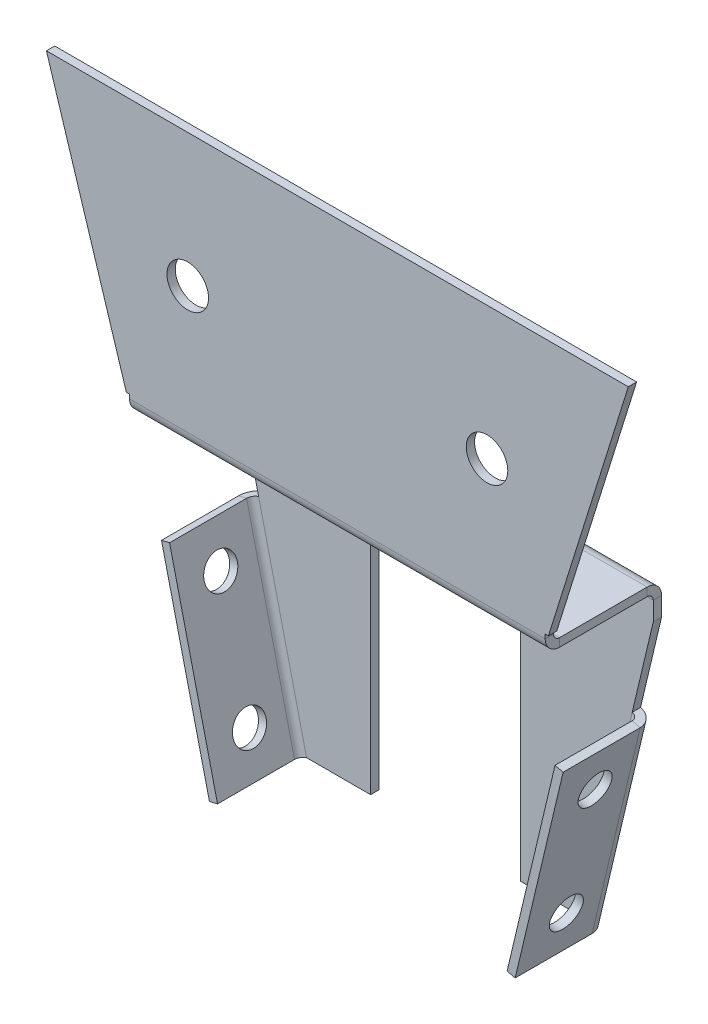
from build123d import *

# Parameters (mm, degrees)
IZIM1_R                         = 2.5
TABAN_FLAN_1_DEPTH              = 1
KENAR_FLAN_1_STRIP_W            = 5.4732
KENAR_FLAN_1_STRIP_H            = 1
KENAR_FLAN_1_STRIP_CUT_DEPTH    = 50
KENAR_FLAN_1_RELIEF_W           = 5.9732
KENAR_FLAN_1_RELIEF_H           = 0.5
KENAR_FLAN_1_RELIEF_CUT_DEPTH   = 1
KENAR_FLAN_1_DEPTH              = 50
KENAR_FLAN_1_START              = 1
KENAR_FLAN_1_FLAT_DEPTH         = 1
KENAR_FLAN_2_STRIP_W            = 5.4732
KENAR_FLAN_2_STRIP_H            = 1
KENAR_FLAN_2_STRIP_CUT_DEPTH    = 16
KENAR_FLAN_2_RELIEF_W           = 5.9732
KENAR_FLAN_2_RELIEF_H           = 0.5
KENAR_FLAN_2_RELIEF_CUT_DEPTH   = 1
KENAR_FLAN_2_STRIP_2_W          = 5.4732
KENAR_FLAN_2_STRIP_2_H          = 1
KENAR_FLAN_2_STRIP_CUT_2_DEPTH  = 16
KENAR_FLAN_2_RELIEF_2_W         = 5.9732
KENAR_FLAN_2_RELIEF_2_H         = 0.5
KENAR_FLAN_2_RELIEF_CUT_2_DEPTH = 1
KENAR_FLAN_2_DEPTH              = 16
KENAR_FLAN_2_BEND_DEPTH         = 16
KES_EKSTR_ZYON1_DEPTH           = 10
KENAR_FLAN_3_DEPTH              = 25
KENAR_FLAN_3_START              = 1
KENAR_FLAN_3_PROFILE_W          = 25
KENAR_FLAN_3_PROFILE_H          = 9.2634
KENAR_FLAN_3_PROFILE_R          = 2
KENAR_FLAN_3_FLAT_DEPTH         = 1
KENAR_FLAN_3_BEND_DEPTH         = 25
KENAR_FLAN_3_PROFILE_2_W        = 25
KENAR_FLAN_3_PROFILE_2_H        = 9.2634
KENAR_FLAN_3_PROFILE_2_R        = 2
KENAR_FLAN_3_FLAT_2_DEPTH       = 1


# Sheet-metal steps are written as plain solids
with BuildPart() as part:
    # Çizim1 → Taban-Flanş1 (new body)
    with BuildSketch(Plane.XY):
        Polygon((-25, 16), (25, 16), (35, 16), (25, -16), (-25, -16), (-35, 16), align=None)
        with Locations((-18, 0)):
            Circle(IZIM1_R, mode=Mode.SUBTRACT)
        with Locations((18, 0)):
            Circle(IZIM1_R, mode=Mode.SUBTRACT)
    extrude(amount=-TABAN_FLAN_1_DEPTH)

    # Kenar-Flanş1 strip (across the edge) → Kenar-Flanş1 strip cut (cut)
    with BuildSketch(Plane(origin=(25, -16, -1), x_dir=(0, 1, 0), z_dir=(-1, 0, 0))):
        with Locations((-2, -0.5)):
            Rectangle(KENAR_FLAN_1_STRIP_W, KENAR_FLAN_1_STRIP_H)
    extrude(amount=KENAR_FLAN_1_STRIP_CUT_DEPTH, mode=Mode.SUBTRACT)

    # Kenar-Flanş1 relief (on the sheet) → Kenar-Flanş1 relief cut (cut)
    with BuildSketch(Plane(origin=(25, -15.2634, -1), x_dir=(0, 1, 0), z_dir=(0, 0, -1))):
        with Locations((-2.4866, 0.25)):
            Rectangle(KENAR_FLAN_1_RELIEF_W, KENAR_FLAN_1_RELIEF_H)
        with Locations((-2.4866, -50.25)):
            Rectangle(KENAR_FLAN_1_RELIEF_W, KENAR_FLAN_1_RELIEF_H)
    extrude(amount=-KENAR_FLAN_1_RELIEF_CUT_DEPTH, mode=Mode.SUBTRACT)

    # Kenar-Flanş1 bend section (across the edge) → Kenar-Flanş1 (add)
    with BuildSketch(Plane(origin=(25, -16, -1), x_dir=(0, 1, 0), z_dir=(-1, 0, 0))):
        with BuildLine():
            Line((-1, 0.7366), (0, 0.7366))
            ThreePointArc((0, 0.7366), (0.215745145, 0.215745145), (0.7366, 0))
            Line((0.7366, 0), (0.7366, -1))
            ThreePointArc((0.7366, -1), (-0.491361636, -0.491361636), (-1, 0.7366))
        make_face()
    extrude(amount=KENAR_FLAN_1_DEPTH)

    # Kenar-Flanş1 profile (on flange) → Kenar-Flanş1 flat (add)
    with BuildSketch(Plane(origin=(0, -16, -1), x_dir=(-1, 0, 0), z_dir=(0, -1, 0)).offset(KENAR_FLAN_1_START)):
        with BuildLine():
            Line((25, 0.7366), (25, 12))
            Line((25, 12), (9, 12))
            ThreePointArc((9, 12), (0, 3), (-9, 12))
            Line((-9, 12), (-25, 12))
            Line((-25, 12), (-25, 0.7366))
            Line((-25, 0.7366), (25, 0.7366))
        make_face()
    extrude(amount=-KENAR_FLAN_1_FLAT_DEPTH)

    # Kenar-Flanş2 strip (across the edge) → Kenar-Flanş2 strip cut (cut)
    with BuildSketch(Plane(origin=(9, -17, -13), x_dir=(0, 0, 1), z_dir=(1, 0, 0))):
        with Locations((-2, -0.5)):
            Rectangle(KENAR_FLAN_2_STRIP_W, KENAR_FLAN_2_STRIP_H)
    extrude(amount=KENAR_FLAN_2_STRIP_CUT_DEPTH, mode=Mode.SUBTRACT)

    # Kenar-Flanş2 relief (on the sheet) → Kenar-Flanş2 relief cut (cut)
    with BuildSketch(Plane(origin=(9, -17, -12.2634), x_dir=(0, 0, 1), z_dir=(0, -1, 0))):
        with Locations((-2.4866, 0.25)):
            Rectangle(KENAR_FLAN_2_RELIEF_W, KENAR_FLAN_2_RELIEF_H)
    extrude(amount=-KENAR_FLAN_2_RELIEF_CUT_DEPTH, mode=Mode.SUBTRACT)

    # Kenar-Flanş2 strip 2 (across the edge) → Kenar-Flanş2 strip cut 2 (cut)
    with BuildSketch(Plane(origin=(-25, -17, -13), x_dir=(0, 0, 1), z_dir=(1, 0, 0))):
        with Locations((-2, -0.5)):
            Rectangle(KENAR_FLAN_2_STRIP_2_W, KENAR_FLAN_2_STRIP_2_H)
    extrude(amount=KENAR_FLAN_2_STRIP_CUT_2_DEPTH, mode=Mode.SUBTRACT)

    # Kenar-Flanş2 relief 2 (on the sheet) → Kenar-Flanş2 relief cut 2 (cut)
    with BuildSketch(Plane(origin=(-25, -17, -12.2634), x_dir=(0, 0, 1), z_dir=(0, -1, 0))):
        with Locations((-2.4866, -16.25)):
            Rectangle(KENAR_FLAN_2_RELIEF_2_W, KENAR_FLAN_2_RELIEF_2_H)
    extrude(amount=-KENAR_FLAN_2_RELIEF_CUT_2_DEPTH, mode=Mode.SUBTRACT)

    # Kenar-Flanş2 section (across the edge) → Kenar-Flanş2 (add)
    with BuildSketch(Plane(origin=(9, -17, -13), x_dir=(0, 0, 1), z_dir=(1, 0, 0))):
        with BuildLine():
            Line((-1, 0.7366), (-1, 38))
            Line((-1, 38), (0, 38))
            Line((0, 38), (0, 0.7366))
            ThreePointArc((0, 0.7366), (0.215745145, 0.215745145), (0.7366, 0))
            Line((0.7366, 0), (0.7366, -1))
            ThreePointArc((0.7366, -1), (-0.491361636, -0.491361636), (-1, 0.7366))
        make_face()
    extrude(amount=KENAR_FLAN_2_DEPTH)

    # Kenar-Flanş2 section 2 (across the edge) → Kenar-Flanş2 bend (add)
    with BuildSketch(Plane(origin=(-25, -17, -13), x_dir=(0, 0, 1), z_dir=(1, 0, 0))):
        with BuildLine():
            Line((-1, 0.7366), (-1, 38))
            Line((-1, 38), (0, 38))
            Line((0, 38), (0, 0.7366))
            ThreePointArc((0, 0.7366), (0.215745145, 0.215745145), (0.7366, 0))
            Line((0.7366, 0), (0.7366, -1))
            ThreePointArc((0.7366, -1), (-0.491361636, -0.491361636), (-1, 0.7366))
        make_face()
    extrude(amount=KENAR_FLAN_2_BEND_DEPTH)

    # Çizim11 → Kes-Ekstrüzyon1 (cut)
    with BuildSketch(Plane(origin=(0, 0, -14), x_dir=(-1, 0, 0), z_dir=(0, 0, -1))):
        Polygon((-16.7, -55), (-25, -20), (-25, -55), align=None)
        Polygon((25, -55), (16.7, -55), (25, -20), align=None)
    extrude(amount=-KES_EKSTR_ZYON1_DEPTH, mode=Mode.SUBTRACT)

    # Kenar-Flanş3 bend section (across the edge) → Kenar-Flanş3 (add)
    with BuildSketch(Plane(origin=(17.41672257, -55.169965638, -13), x_dir=(-0.973014620822144, 0.23074346722353695, 3.4914813388431334e-15), z_dir=(0.23074346722353695, 0.973014620822144, 0))):
        with BuildLine():
            Line((-1, 0.7366), (0, 0.7366))
            ThreePointArc((0, 0.7366), (0.215745145, 0.215745145), (0.7366, 0))
            Line((0.7366, 0), (0.7366, -1))
            ThreePointArc((0.7366, -1), (-0.491361636, -0.491361636), (-1, 0.7366))
        make_face()
    extrude(amount=KENAR_FLAN_3_DEPTH)

    # Kenar-Flanş3 profile (on flange) → Kenar-Flanş3 flat (add)
    with BuildSketch(Plane(origin=(28.875994223, -6.847735773, -13), x_dir=(0.23074346722353695, 0.973014620822144, 0), z_dir=(0.973014620822144, -0.23074346722353695, -3.4914813388431334e-15)).offset(KENAR_FLAN_3_START)):
        with Locations((-37.162388243, 5.3683)):
            Rectangle(KENAR_FLAN_3_PROFILE_W, KENAR_FLAN_3_PROFILE_H)
        with Locations((-44.662388243, 5)):
            Circle(KENAR_FLAN_3_PROFILE_R, mode=Mode.SUBTRACT)
        with Locations((-29.662388243, 5)):
            Circle(KENAR_FLAN_3_PROFILE_R, mode=Mode.SUBTRACT)
    extrude(amount=-KENAR_FLAN_3_FLAT_DEPTH)

    # Kenar-Flanş3 bend section 2 (across the edge) → Kenar-Flanş3 bend (add)
    with BuildSketch(Plane(origin=(-23.18530925, -30.844600117, -13), x_dir=(0.973014620822144, 0.2307434672235371, 3.807964708569791e-15), z_dir=(0.2307434672235371, -0.973014620822144, 0))):
        with BuildLine():
            Line((-1, 0.7366), (0, 0.7366))
            ThreePointArc((0, 0.7366), (0.215745145, 0.215745145), (0.7366, 0))
            Line((0.7366, 0), (0.7366, -1))
            ThreePointArc((0.7366, -1), (-0.491361636, -0.491361636), (-1, 0.7366))
        make_face()
    extrude(amount=KENAR_FLAN_3_BEND_DEPTH)

    # Kenar-Flanş3 profile 2 (on flange) → Kenar-Flanş3 flat 2 (add)
    with BuildSketch(Plane(origin=(-28.875994223, -6.847735773, -13), x_dir=(0.2307434672235371, -0.973014620822144, 0), z_dir=(-0.973014620822144, -0.2307434672235371, -3.807964708569791e-15)).offset(KENAR_FLAN_3_START)):
        with Locations((37.162388243, 5.3683)):
            Rectangle(KENAR_FLAN_3_PROFILE_2_W, KENAR_FLAN_3_PROFILE_2_H)
        with Locations((29.662388243, 5)):
            Circle(KENAR_FLAN_3_PROFILE_2_R, mode=Mode.SUBTRACT)
        with Locations((44.662388243, 5)):
            Circle(KENAR_FLAN_3_PROFILE_2_R, mode=Mode.SUBTRACT)
    extrude(amount=-KENAR_FLAN_3_FLAT_2_DEPTH)


solid = part.part
